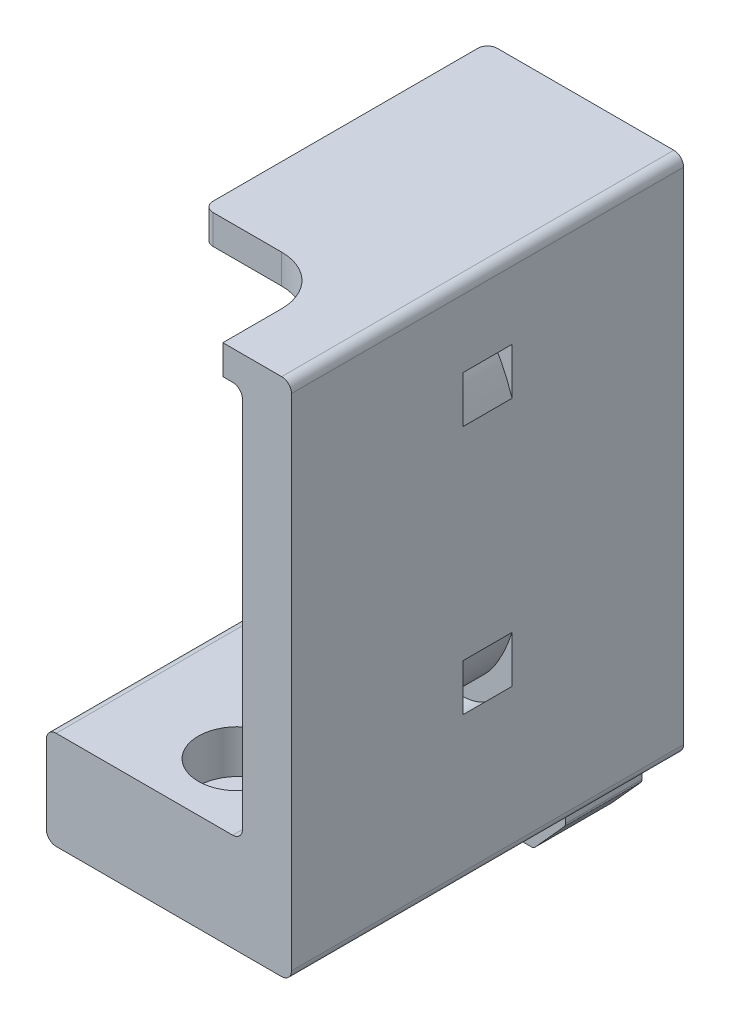
from build123d import *
from OCP.BRepFilletAPI import BRepFilletAPI_MakeFillet

# Parameters (mm, degrees)
BOSS_EXTRUDE1_DEPTH                                 = 20
CBORE_FOR_M4_HEX_SOCKET_HEAD_CAP_SCREW1_D           = 4.5
CBORE_FOR_M4_HEX_SOCKET_HEAD_CAP_SCREW1_DEPTH       = 10
CBORE_FOR_M4_HEX_SOCKET_HEAD_CAP_SCREW1_CBORE_D     = 8
CBORE_FOR_M4_HEX_SOCKET_HEAD_CAP_SCREW1_CBORE_DEPTH = 4.4
BOSS_EXTRUDE3_DEPTH                                 = 7.8
CUT_EXTRUDE1_DEPTH                                  = 2.4
FILLET3_R                                           = 0.5
CUT_SWEEP1_START                                    = -2.5
CUT_SWEEP1_DEPTH                                    = 5
CUT_EXTRUDE2_REACH                                  = 67.401
SKETCH14_R                                          = 4
FILLET4_R1                                          = 1
FILLET4_R2                                          = 5


# Read off the part's stored shape, not the designer's step: Cut-Sweep1
with BuildPart() as part:
    # Sketch1 → Boss-Extrude1 (new, symmetric)
    with BuildSketch(Plane.XY):
        Polygon((-12.5, 10), (7.5, 10), (7.5, 50), (-7.5, 50), (-7.5, 53), (12.5, 53), (12.5, 0), (-12.5, 0), align=None)
    extrude(amount=BOSS_EXTRUDE1_DEPTH, both=True)

    # CBORE for M4 Hex Socket Head Cap Screw1
    with Locations(Plane(origin=(0, 10, 0), x_dir=(1, 0, 0), z_dir=(0, 1, 0))):
        with Locations((0, -13)):
            CounterBoreHole(CBORE_FOR_M4_HEX_SOCKET_HEAD_CAP_SCREW1_D / 2, CBORE_FOR_M4_HEX_SOCKET_HEAD_CAP_SCREW1_CBORE_D / 2, CBORE_FOR_M4_HEX_SOCKET_HEAD_CAP_SCREW1_CBORE_DEPTH, depth=CBORE_FOR_M4_HEX_SOCKET_HEAD_CAP_SCREW1_DEPTH)

    # Sketch5 → Boss-Extrude3 (add)
    with BuildSketch(Plane(origin=(0, 0, -20), x_dir=(-1, 0, 0), z_dir=(0, 0, -1))):
        Polygon((-5, -8), (5, -8), (8.25, -4.4), (8.25, -2.4), (3.9, -2.4), (3.9, 0), (-3.9, 0), (-3.9, -2.4), (-8.25, -2.4), (-8.25, -4.4), align=None)
    extrude(amount=-BOSS_EXTRUDE3_DEPTH)

    # Sketch6 → Cut-Extrude1 (cut)
    with BuildSketch(Plane(origin=(0, -2.4, 0), x_dir=(1, 0, 0), z_dir=(0, 1, 0))):
        with BuildLine():
            ThreePointArc((-3.9, 16.1), (-2.757716447, 18.857716447), (0, 20))
            Line((0, 20), (-3.9, 20))
            Line((-3.9, 20), (-3.9, 16.1))
        make_face()
        with BuildLine():
            Line((3.9, 12.2), (3.9, 16.1))
            ThreePointArc((3.9, 16.1), (2.757716447, 13.342283553), (0, 12.2))
            Line((0, 12.2), (3.9, 12.2))
        make_face()
    extrude(amount=CUT_EXTRUDE1_DEPTH, mode=Mode.SUBTRACT)

    # Fillet3
    fillet3_edges = [part.edges().sort_by_distance(p)[0] for p in [
        (3.9, 0, -18.05),
        (2.757716447, 0, -13.342283553),
        (-1.95, 0, -12.2),
    ]]
    fillet(fillet3_edges, radius=FILLET3_R)
    fillet3_2_edges = [part.edges().sort_by_distance(p)[0] for p in [
        (-3.9, 0, -14.15),
        (-2.757716447, 0, -18.857716447),
    ]]
    fillet(fillet3_2_edges, radius=FILLET3_R)
    fillet3_3_edges = [part.edges().sort_by_distance(p)[0] for p in [
        (-8.25, -2.4, -16.1),
    ]]
    fillet(fillet3_3_edges, radius=FILLET3_R)
    fillet3_4_edges = [part.edges().sort_by_distance(p)[0] for p in [
        (-8.25, -4.4, -16.1),
    ]]
    fillet(fillet3_4_edges, radius=FILLET3_R)
    fillet3_5_edges = [part.edges().sort_by_distance(p)[0] for p in [
        (-5, -8, -16.1),
    ]]
    fillet(fillet3_5_edges, radius=FILLET3_R)
    fillet3_6_edges = [part.edges().sort_by_distance(p)[0] for p in [
        (5, -8, -16.1),
    ]]
    fillet(fillet3_6_edges, radius=FILLET3_R)
    fillet3_7_edges = [part.edges().sort_by_distance(p)[0] for p in [
        (8.25, -4.4, -16.1),
    ]]
    fillet(fillet3_7_edges, radius=FILLET3_R)
    fillet3_8_edges = [part.edges().sort_by_distance(p)[0] for p in [
        (8.25, -2.4, -16.1),
    ]]
    fillet(fillet3_8_edges, radius=FILLET3_R)

    # Cut-Sweep1 outline → Cut-Sweep1 (cut)
    with BuildSketch(Plane.XY.offset(CUT_SWEEP1_START)):
        with BuildLine():
            Line((12.500000017, 40.338970285), (12.5, 45.105483834))
            add(Edge.make_bspline(
                [(12.5, 45.105483834), (12.059714128, 45.789978249), (11.581411154, 46.38791258), (10.025035585, 47.892146935), (8.787180136, 48.5), (7.5, 48.5)],
                knots=[0.656472281, 0.656472281, 0.656472281, 0.656472281, 0.6875, 0.6875, 0.75, 0.75, 0.75, 0.75], degree=3))
            Line((7.5, 48.5), (7.5, 46.5))
            add(Edge.make_bspline(
                [(12.500000017, 40.338970285), (12.309154865, 40.920252732), (12.103143429, 41.469478304), (11.227294674, 43.513125401), (10.449149583, 44.700789342), (8.901182872, 46.196896563), (8.176315005, 46.5), (7.5, 46.5)],
                knots=[0.604163443, 0.604163443, 0.604163443, 0.604163443, 0.625, 0.625, 0.6875, 0.6875, 0.75, 0.75, 0.75, 0.75], degree=3))
        make_face()
        with BuildLine():
            Line((12.5, 14.894516166), (12.500000017, 19.661029715))
            add(Edge.make_bspline(
                [(7.5, 13.5), (8.176315005, 13.5), (8.901182872, 13.803103437), (10.449149583, 15.299210658), (11.227294674, 16.486874599), (12.103143429, 18.530521696), (12.309154865, 19.079747268), (12.500000017, 19.661029715)],
                knots=[0.25, 0.25, 0.25, 0.25, 0.3125, 0.3125, 0.375, 0.375, 0.395836557, 0.395836557, 0.395836557, 0.395836557], degree=3))
            Line((7.5, 13.5), (7.5, 11.5))
            add(Edge.make_bspline(
                [(7.5, 11.5), (8.787180136, 11.5), (10.025035585, 12.107853065), (11.581411154, 13.61208742), (12.059714128, 14.210021751), (12.5, 14.894516166)],
                knots=[0.25, 0.25, 0.25, 0.25, 0.3125, 0.3125, 0.343527719, 0.343527719, 0.343527719, 0.343527719], degree=3))
        make_face()
    extrude(amount=CUT_SWEEP1_DEPTH, mode=Mode.SUBTRACT)

    # Sketch14 → Cut-Extrude2 (cut, up to next)
    with BuildSketch(Plane(origin=(0, 53, 0), x_dir=(1, 0, 0), z_dir=(0, 1, 0)), mode=Mode.PRIVATE) as cut_extrude2_sk1:
        Polygon((-7.5, -20), (5.5, -20), (5.5, -9), (0, -9), (-7.5, -9), align=None)
        with BuildLine():
            ThreePointArc((4, -13), (-2.828427125, -15.828427125), (0, -9))
            ThreePointArc((0, -9), (2.828427125, -10.171572875), (4, -13))
        make_face(mode=Mode.SUBTRACT)
    cut_extrude2_tool1 = extrude(cut_extrude2_sk1.sketch, amount=-CUT_EXTRUDE2_REACH, mode=Mode.PRIVATE) & part.part
    # Sketch14 → Cut-Extrude2 (cut, up to next)
    with BuildSketch(Plane(origin=(0, 53, 0), x_dir=(1, 0, 0), z_dir=(0, 1, 0)), mode=Mode.PRIVATE) as cut_extrude2_sk2:
        with Locations(Location((0, -13, 0), (0, 0, 270))):
            Circle(SKETCH14_R)
    cut_extrude2_tool2 = extrude(cut_extrude2_sk2.sketch, amount=-CUT_EXTRUDE2_REACH, mode=Mode.PRIVATE) & part.part
    add(cut_extrude2_tool1.solids().sort_by_distance((-1, 53, 19.829706))[0], mode=Mode.SUBTRACT)
    add(cut_extrude2_tool2.solids().sort_by_distance((0, 53, 13))[0], mode=Mode.SUBTRACT)

    # Fillet4: one fillet with a radius per group of edges: ONE call of the kernel's fillet builder (fillet() takes one radius for all edges)
    fillet4_edges_1 = [part.edges().sort_by_distance(p)[0] for p in [
        (-12.5, 10, 0),
        (7.5, 10, 0),
        (7.5, 50, 0),
        (12.5, 53, 0),
        (12.5, 0, 0),
        (-12.5, 0, 0),
        (-7.5, 51.5, 9),
        (-7.5, 51.5, -20),
    ]]
    fillet4_edges_2 = [part.edges().sort_by_distance(p)[0] for p in [
        (5.5, 51.5, 9),
    ]]
    fillet4 = BRepFilletAPI_MakeFillet(part.part.solid().wrapped)
    for e in fillet4_edges_1:
        fillet4.Add(FILLET4_R1, e.wrapped)
    for e in fillet4_edges_2:
        fillet4.Add(FILLET4_R2, e.wrapped)
    add(Compound.cast(fillet4.Shape()), mode=Mode.REPLACE)


solid = part.part
